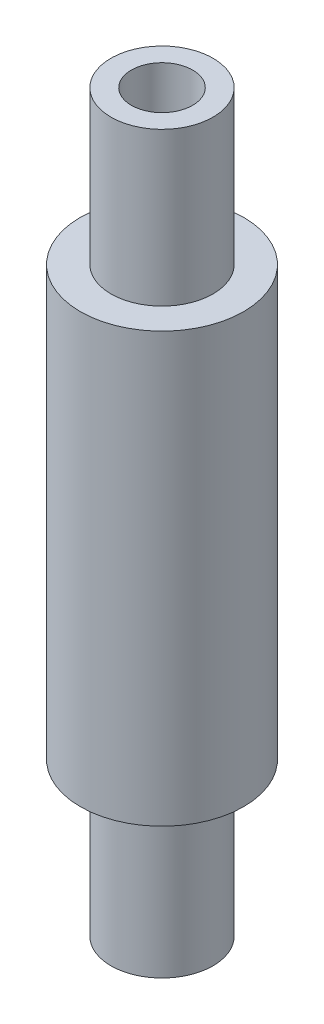
from build123d import *

# Parameters (mm, degrees)
SKETCH1_R           = 4
SKETCH1_R_2         = 1.25
BOSS_EXTRUDE1_DEPTH = 21
SKETCH2_R           = 2.5
BOSS_EXTRUDE2_DEPTH = 7.5
BOSS_EXTRUDE3_START = 7.5
SKETCH3_R           = 2.5
BOSS_EXTRUDE3_DEPTH = 7.5
SKETCH4_R           = 1.5
CUT_EXTRUDE1_DEPTH  = 37.441734317


with BuildPart() as part:
    # Sketch1 → Boss-Extrude1 (new body)
    with BuildSketch(Plane(origin=(0, 0, 0), x_dir=(1, 0, 0), z_dir=(0, 1, 0))):
        Circle(SKETCH1_R)
        Circle(SKETCH1_R_2, mode=Mode.SUBTRACT)
    extrude(amount=BOSS_EXTRUDE1_DEPTH)

    # Sketch2 → Boss-Extrude2 (add)
    with BuildSketch(Plane.XZ):
        Circle(SKETCH2_R)
    extrude(amount=BOSS_EXTRUDE2_DEPTH)

    # Sketch3 → Boss-Extrude3 (add)
    with BuildSketch(Plane(origin=(0, 21, 0), x_dir=(1, 0, 0), z_dir=(0, 1, 0)).offset(BOSS_EXTRUDE3_START)):
        Circle(SKETCH3_R)
    extrude(amount=-BOSS_EXTRUDE3_DEPTH)

    # Sketch4 → Cut-Extrude1 (cut, through all)
    with BuildSketch(Plane(origin=(0, 28.5, 0), x_dir=(1, 0, 0), z_dir=(0, 1, 0))):
        Circle(SKETCH4_R)
    extrude(amount=-CUT_EXTRUDE1_DEPTH, mode=Mode.SUBTRACT)


solid = part.part
